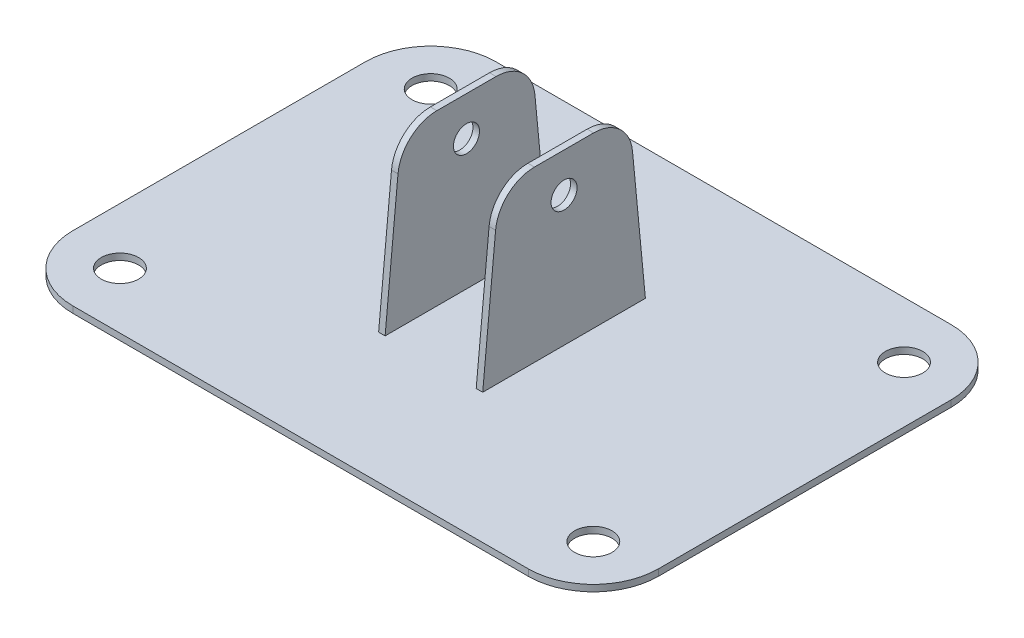
from build123d import *

# Parameters (mm, degrees)
SKETCH1_W            = 90
SKETCH1_H            = 65
SKETCH1_R            = 2.875
BOSS_EXTRUDE1_DEPTH  = 1
FILLET1_R            = 10
BOSS_EXTRUDE2_START  = -37
SKETCH2_R            = 2
BOSS_EXTRUDE2_DEPTH  = 1
FILLET2_R            = 6
FILLET2_OF_MIRROR1_R = 6


with BuildPart() as part:
    # Sketch1 → Boss-Extrude1 (new body)
    with BuildSketch(Plane(origin=(0, 0, 0), x_dir=(1, 0, 0), z_dir=(0, 1, 0))):
        Rectangle(SKETCH1_W, SKETCH1_H)
        with Locations((-36.375, 23.875)):
            Circle(SKETCH1_R, mode=Mode.SUBTRACT)
        with Locations((36.375, 23.875)):
            Circle(SKETCH1_R, mode=Mode.SUBTRACT)
        with Locations((36.375, -23.875)):
            Circle(SKETCH1_R, mode=Mode.SUBTRACT)
        with Locations((-36.375, -23.875)):
            Circle(SKETCH1_R, mode=Mode.SUBTRACT)
    extrude(amount=BOSS_EXTRUDE1_DEPTH)

    # Fillet1
    fillet1_edges = [part.edges().sort_by_distance(p)[0] for p in [
        (-45, 0.5, 32.5),
        (-45, 0.5, -32.5),
        (45, 0.5, -32.5),
        (45, 0.5, 32.5),
    ]]
    fillet(fillet1_edges, radius=FILLET1_R)

    # Sketch2 → Boss-Extrude2 (add)
    with BuildSketch(Plane(origin=(45, 0, 0), x_dir=(0, 0, -1), z_dir=(1, 0, 0)).offset(BOSS_EXTRUDE2_START)):
        Polygon((-12.5, 1), (-10, 27), (10, 27), (12.5, 1), align=None)
        with Locations((0, 21)):
            Circle(SKETCH2_R, mode=Mode.SUBTRACT)
    boss_extrude2 = extrude(amount=-BOSS_EXTRUDE2_DEPTH)

    # Fillet2
    fillet2_edges = [part.edges().sort_by_distance(p)[0] for p in [
        (7.5, 27, 10),
        (7.5, 27, -10),
    ]]
    fillet(fillet2_edges, radius=FILLET2_R)

    # Mirror1: Boss-Extrude2 across plane
    add(boss_extrude2.mirror(Plane.ZY))

    # Fillet2 of Mirror1
    fillet2_of_mirror1_edges = [part.edges().sort_by_distance(p)[0] for p in [
        (-7.5, 27, 10),
        (-7.5, 27, -10),
    ]]
    fillet(fillet2_of_mirror1_edges, radius=FILLET2_OF_MIRROR1_R)


solid = part.part
